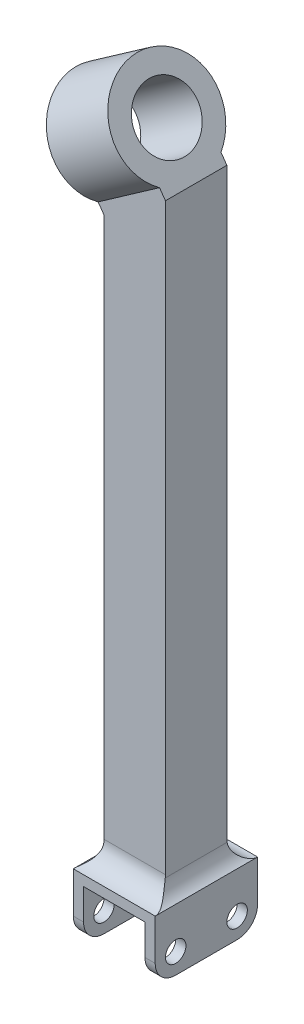
from build123d import *

# Parameters (mm, degrees)
BOSS_EXTRUDE1_DEPTH = 50
CUT_EXTRUDE4_DEPTH  = 10
CUT_EXTRUDE5_DEPTH  = 10
SKETCH6_R           = 15
CUT_EXTRUDE6_DEPTH  = 301.947465254
CUT_EXTRUDE7_DEPTH  = 301.947465254
SKETCH8_W           = 30
SKETCH8_H           = 5
CUT_EXTRUDE8_DEPTH  = 346.907627132
SKETCH9_W           = 40
SKETCH9_H           = 50
BOSS_EXTRUDE2_DEPTH = 30
FILLET1_R           = 10
SKETCH10_W          = 30
SKETCH10_H          = 25
CUT_EXTRUDE9_DEPTH  = 347.377087182
SKETCH11_R          = 5
CUT_EXTRUDE10_DEPTH = 347.917982419


with BuildPart() as part:
    # Sketch1 → Boss-Extrude1 (new body)
    with BuildSketch(Plane.XY):
        Polygon((0, 0), (30, 0), (30, 300), (1.321178182, 340.957602214), (-28.678821818, 319.951376068), (0, 278.993773854), align=None)
    extrude(amount=BOSS_EXTRUDE1_DEPTH)

    # Sketch3 → Cut-Extrude4 (cut)
    with BuildSketch(Plane.XY.offset(50)):
        Polygon((30, 300), (0, 278.993773854), (0, 5), (30, 5), align=None)
    extrude(amount=-CUT_EXTRUDE4_DEPTH, mode=Mode.SUBTRACT)

    # Sketch4 → Cut-Extrude5 (cut)
    with BuildSketch(Plane(origin=(0, 0, 0), x_dir=(-1, 0, 0), z_dir=(0, 0, -1))):
        Polygon((-30, 300), (0, 278.993773854), (0, 5), (-30, 5), align=None)
    extrude(amount=-CUT_EXTRUDE5_DEPTH, mode=Mode.SUBTRACT)

    # Sketch6 → Cut-Extrude6 (cut, through all)
    with BuildSketch(Plane(origin=(161.084195268, 112.792367813, 0), x_dir=(0, 0, -1), z_dir=(0.819152044288991, 0.5735764363510472, 0))):
        with Locations(Location((-25, 253.538320196, 0), (0, 0, 90))):
            Circle(SKETCH6_R)
    extrude(amount=-CUT_EXTRUDE6_DEPTH, mode=Mode.SUBTRACT)

    # Sketch7 → Cut-Extrude7 (cut, through all)
    with BuildSketch(Plane(origin=(161.084195268, 112.792367813, 0), x_dir=(0, 0, -1), z_dir=(0.819152044288991, 0.5735764363510472, 0))):
        with BuildLine():
            Line((-50, 228.538320196), (-40, 228.538320196))
            Line((-40, 228.538320196), (-40, 233.538320196))
            ThreePointArc((-40, 233.538320196), (-47.360679775, 242.357980309), (-50, 253.538320196))
            Line((-50, 253.538320196), (-50, 228.538320196))
        make_face()
        with BuildLine():
            Line((-50, 278.538320196), (-50, 253.538320196))
            ThreePointArc((-50, 253.538320196), (-42.67766953, 271.215989726), (-25, 278.538320196))
            Line((-25, 278.538320196), (-50, 278.538320196))
        make_face()
        with BuildLine():
            Line((0, 278.538320196), (-25, 278.538320196))
            ThreePointArc((-25, 278.538320196), (-7.32233047, 271.215989726), (0, 253.538320196))
            Line((0, 253.538320196), (0, 278.538320196))
        make_face()
        with BuildLine():
            Line((0, 228.538320196), (0, 253.538320196))
            ThreePointArc((0, 253.538320196), (-2.639320225, 242.357980309), (-10, 233.538320196))
            Line((-10, 233.538320196), (-10, 228.538320196))
            Line((-10, 228.538320196), (0, 228.538320196))
        make_face()
    extrude(amount=-CUT_EXTRUDE7_DEPTH, mode=Mode.SUBTRACT)

    # Sketch8 → Cut-Extrude8 (cut, through all)
    with BuildSketch(Plane.XY.offset(50)):
        with Locations((15, 2.5)):
            Rectangle(SKETCH8_W, SKETCH8_H)
    extrude(amount=-CUT_EXTRUDE8_DEPTH, mode=Mode.SUBTRACT)

    # Sketch9 → Boss-Extrude2 (add)
    with BuildSketch(Plane.XZ.offset(-5)):
        with Locations((15, 25)):
            Rectangle(SKETCH9_W, SKETCH9_H)
    extrude(amount=BOSS_EXTRUDE2_DEPTH)

    # Fillet1
    # the kernel refuses this fillet: 10 mm, written as the material it adds along each edge
    with BuildSketch(Plane(origin=(0, 5, 40), x_dir=(-1, 0, 0), z_dir=(0, 0, -1))) as fillet1_piece_1:
        with BuildLine():
            CenterArc((10, 8.660254038), FILLET1_R, 180, 60)
            Line((0, 8.660254038), (0, 0))
            Line((0, 0), (5, 0))
        make_face()
    extrude(amount=30)
    with BuildSketch(Plane(origin=(30, 5, 40), x_dir=(1, 0, 0), z_dir=(0, 0, -1))) as fillet1_piece_2:
        with BuildLine():
            CenterArc((10, -8.660254038), FILLET1_R, 120, 60)
            Line((0, -8.660254038), (0, 0))
            Line((0, 0), (5, 0))
        make_face()
    extrude(amount=30)
    with BuildSketch(Plane(origin=(0, 5, 40), x_dir=(0, 0, 1), z_dir=(1, 0, 0))) as fillet1_piece_3:
        with BuildLine():
            CenterArc((FILLET1_R, -FILLET1_R), FILLET1_R, 90, 90)
            Line((0, -FILLET1_R), (0, 0))
            Line((0, 0), (FILLET1_R, 0))
        make_face()
    extrude(amount=30)
    with BuildSketch(Plane(origin=(0, 5, 10), x_dir=(0, 0, -1), z_dir=(1, 0, 0))) as fillet1_piece_4:
        with BuildLine():
            CenterArc((FILLET1_R, FILLET1_R), FILLET1_R, 180, 90)
            Line((0, FILLET1_R), (0, 0))
            Line((0, 0), (FILLET1_R, 0))
        make_face()
    extrude(amount=30)
    with BuildSketch(Plane(origin=(-25, 5, 40), x_dir=(0, 0, 1), z_dir=(1, 0, 0))) as fillet1_piece_5a_section:
        with BuildLine():
            CenterArc((FILLET1_R, -FILLET1_R), FILLET1_R, 90, 90)
            Line((0, -FILLET1_R), (0, 0))
            Line((0, 0), (FILLET1_R, 0))
        make_face()
    fillet1_piece_5a = extrude(amount=55, mode=Mode.PRIVATE)
    fillet1_piece_5a = split(fillet1_piece_5a, bisect_by=Plane(origin=(-5, 5, 40), z_dir=(1, 0, 0)), keep=Keep.TOP, mode=Mode.PRIVATE)
    fillet1_piece_5a = split(fillet1_piece_5a, bisect_by=Plane(origin=(0, 5, 40), z_dir=(-1, 0, 0)), keep=Keep.TOP, mode=Mode.PRIVATE)
    with BuildSketch(Plane(origin=(0, 5, 61.650635095), x_dir=(-1, 0, 0), z_dir=(0, 0, -1))) as fillet1_piece_5b_section:
        with BuildLine():
            CenterArc((10, 8.660254038), FILLET1_R, 180, 60)
            Line((0, 8.660254038), (0, 0))
            Line((0, 0), (5, 0))
        make_face()
    fillet1_piece_5b = extrude(amount=51.650635095, mode=Mode.PRIVATE)
    fillet1_piece_5b = split(fillet1_piece_5b, bisect_by=Plane(origin=(0, 5, 50), z_dir=(0, 0, -1)), keep=Keep.TOP, mode=Mode.PRIVATE)
    fillet1_piece_5b = split(fillet1_piece_5b, bisect_by=Plane(origin=(0, 5, 40), z_dir=(0, 0, 1)), keep=Keep.TOP, mode=Mode.PRIVATE)
    fillet1_piece_5 = fillet1_piece_5a & fillet1_piece_5b
    add(fillet1_piece_5)
    with BuildSketch(Plane(origin=(-25, 5, 10), x_dir=(0, 0, -1), z_dir=(1, 0, 0))) as fillet1_piece_6a_section:
        with BuildLine():
            CenterArc((FILLET1_R, FILLET1_R), FILLET1_R, 180, 90)
            Line((0, FILLET1_R), (0, 0))
            Line((0, 0), (FILLET1_R, 0))
        make_face()
    fillet1_piece_6a = extrude(amount=55, mode=Mode.PRIVATE)
    fillet1_piece_6a = split(fillet1_piece_6a, bisect_by=Plane(origin=(-5, 5, 10), z_dir=(1, 0, 0)), keep=Keep.TOP, mode=Mode.PRIVATE)
    fillet1_piece_6a = split(fillet1_piece_6a, bisect_by=Plane(origin=(0, 5, 10), z_dir=(-1, 0, 0)), keep=Keep.TOP, mode=Mode.PRIVATE)
    with BuildSketch(Plane(origin=(0, 5, 40), x_dir=(-1, 0, 0), z_dir=(0, 0, -1))) as fillet1_piece_6b_section:
        with BuildLine():
            CenterArc((10, 8.660254038), FILLET1_R, 180, 60)
            Line((0, 8.660254038), (0, 0))
            Line((0, 0), (5, 0))
        make_face()
    fillet1_piece_6b = extrude(amount=51.650635095, mode=Mode.PRIVATE)
    fillet1_piece_6b = split(fillet1_piece_6b, bisect_by=Plane(origin=(0, 5, 0), z_dir=(0, 0, 1)), keep=Keep.TOP, mode=Mode.PRIVATE)
    fillet1_piece_6b = split(fillet1_piece_6b, bisect_by=Plane(origin=(0, 5, 10), z_dir=(0, 0, -1)), keep=Keep.TOP, mode=Mode.PRIVATE)
    fillet1_piece_6 = fillet1_piece_6a & fillet1_piece_6b
    add(fillet1_piece_6)
    with BuildSketch(Plane(origin=(0, 5, 40), x_dir=(0, 0, 1), z_dir=(1, 0, 0))) as fillet1_piece_7a_section:
        with BuildLine():
            CenterArc((FILLET1_R, -FILLET1_R), FILLET1_R, 90, 90)
            Line((0, -FILLET1_R), (0, 0))
            Line((0, 0), (FILLET1_R, 0))
        make_face()
    fillet1_piece_7a = extrude(amount=55, mode=Mode.PRIVATE)
    fillet1_piece_7a = split(fillet1_piece_7a, bisect_by=Plane(origin=(35, 5, 40), z_dir=(-1, 0, 0)), keep=Keep.TOP, mode=Mode.PRIVATE)
    fillet1_piece_7a = split(fillet1_piece_7a, bisect_by=Plane(origin=(30, 5, 40), z_dir=(1, 0, 0)), keep=Keep.TOP, mode=Mode.PRIVATE)
    with BuildSketch(Plane(origin=(30, 5, 61.650635095), x_dir=(1, 0, 0), z_dir=(0, 0, -1))) as fillet1_piece_7b_section:
        with BuildLine():
            CenterArc((10, -8.660254038), FILLET1_R, 120, 60)
            Line((0, -8.660254038), (0, 0))
            Line((0, 0), (5, 0))
        make_face()
    fillet1_piece_7b = extrude(amount=51.650635095, mode=Mode.PRIVATE)
    fillet1_piece_7b = split(fillet1_piece_7b, bisect_by=Plane(origin=(30, 5, 50), z_dir=(0, 0, -1)), keep=Keep.TOP, mode=Mode.PRIVATE)
    fillet1_piece_7b = split(fillet1_piece_7b, bisect_by=Plane(origin=(30, 5, 40), z_dir=(0, 0, 1)), keep=Keep.TOP, mode=Mode.PRIVATE)
    fillet1_piece_7 = fillet1_piece_7a & fillet1_piece_7b
    add(fillet1_piece_7)
    with BuildSketch(Plane(origin=(30, 5, 40), x_dir=(1, 0, 0), z_dir=(0, 0, -1))) as fillet1_piece_8a_section:
        with BuildLine():
            CenterArc((10, -8.660254038), FILLET1_R, 120, 60)
            Line((0, -8.660254038), (0, 0))
            Line((0, 0), (5, 0))
        make_face()
    fillet1_piece_8a = extrude(amount=51.650635095, mode=Mode.PRIVATE)
    fillet1_piece_8a = split(fillet1_piece_8a, bisect_by=Plane(origin=(30, 5, 0), z_dir=(0, 0, 1)), keep=Keep.TOP, mode=Mode.PRIVATE)
    fillet1_piece_8a = split(fillet1_piece_8a, bisect_by=Plane(origin=(30, 5, 10), z_dir=(0, 0, -1)), keep=Keep.TOP, mode=Mode.PRIVATE)
    with BuildSketch(Plane(origin=(0, 5, 10), x_dir=(0, 0, -1), z_dir=(1, 0, 0))) as fillet1_piece_8b_section:
        with BuildLine():
            CenterArc((FILLET1_R, FILLET1_R), FILLET1_R, 180, 90)
            Line((0, FILLET1_R), (0, 0))
            Line((0, 0), (FILLET1_R, 0))
        make_face()
    fillet1_piece_8b = extrude(amount=55, mode=Mode.PRIVATE)
    fillet1_piece_8b = split(fillet1_piece_8b, bisect_by=Plane(origin=(35, 5, 10), z_dir=(-1, 0, 0)), keep=Keep.TOP, mode=Mode.PRIVATE)
    fillet1_piece_8b = split(fillet1_piece_8b, bisect_by=Plane(origin=(30, 5, 10), z_dir=(1, 0, 0)), keep=Keep.TOP, mode=Mode.PRIVATE)
    fillet1_piece_8 = fillet1_piece_8a & fillet1_piece_8b
    add(fillet1_piece_8)
    # the kernel refuses this fillet: 10 mm, written as the material it takes off along each edge
    with BuildSketch(Plane(origin=(60, -25, 0), x_dir=(0, 1, 0), z_dir=(-1, 0, 0)), Plane(origin=(-30, -25, 50), x_dir=(0, 1, 0), z_dir=(1, 0, 0))) as fillet1_2_piece_1:
        with BuildLine():
            CenterArc((FILLET1_R, -FILLET1_R), FILLET1_R, 90, 90)
            Line((0, -FILLET1_R), (0, 0))
            Line((0, 0), (FILLET1_R, 0))
        make_face()
    extrude(amount=90, mode=Mode.SUBTRACT)

    # Sketch10 → Cut-Extrude9 (cut, through all)
    with BuildSketch(Plane(origin=(0, 0, 0), x_dir=(-1, 0, 0), z_dir=(0, 0, -1))):
        with Locations((-15, -12.5)):
            Rectangle(SKETCH10_W, SKETCH10_H)
    extrude(amount=-CUT_EXTRUDE9_DEPTH, mode=Mode.SUBTRACT)

    # Sketch11 → Cut-Extrude10 (cut, through all)
    with BuildSketch(Plane.ZY.offset(5)):
        with Locations((10, -15)):
            Circle(SKETCH11_R)
        with Locations((40, -15)):
            Circle(SKETCH11_R)
    extrude(amount=-CUT_EXTRUDE10_DEPTH, mode=Mode.SUBTRACT)


solid = part.part
